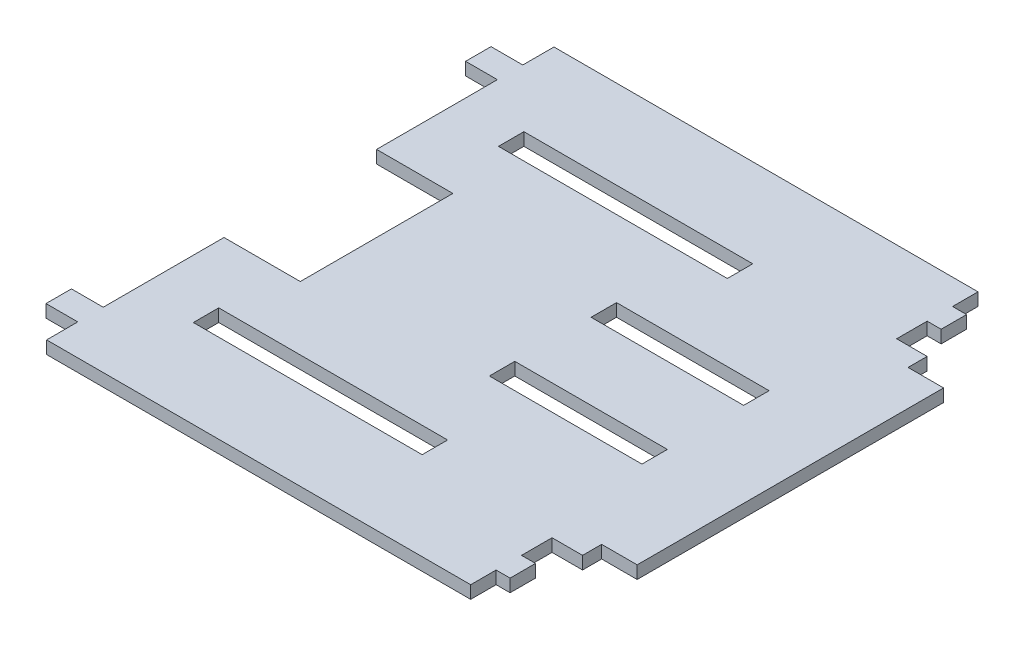
from build123d import *

# Parameters (mm, degrees)
CROQUIS2_W              = 60
CROQUIS2_H              = 10
CROQUIS2_W_2            = 90
SALIENTE_EXTRUIR1_DEPTH = 5
CORTAR_EXTRUIR1_DEPTH   = 10


with BuildPart() as part:
    # Croquis2 → Saliente-Extruir1 (new body)
    with BuildSketch(Plane(origin=(0, 0, 0), x_dir=(1, 0, 0), z_dir=(0, 1, 0))):
        Polygon((119.248757736, -67.751242264), (119.248757736, 67.751242264), (87.248757736, 67.751242264), (87.248757736, 79.751242264), (92.748757736, 79.751242264), (92.748757736, 89.751242264), (87.248757736, 89.751242264), (87.248757736, 99.751242264), (-79.502303886, 99.751242264), (-79.502303886, 87.5), (-92.002303886, 87.5), (-92.002303886, 77.5), (-79.502303886, 77.5), (-79.502303886, 30), (-49.502303886, 30), (-49.502303886, -30), (-79.502303886, -30), (-79.502303886, -77.5), (-92.002303886, -77.5), (-92.002303886, -87.5), (-79.502303886, -87.5), (-79.502303886, -99.751242264), (87.248757736, -99.751242264), (87.248757736, -89.751242264), (92.748757736, -89.751242264), (92.748757736, -79.751242264), (87.248757736, -79.751242264), (87.248757736, -67.751242264), align=None)
        with Locations((49.851646293, 20)):
            Rectangle(CROQUIS2_W, CROQUIS2_H, mode=Mode.SUBTRACT)
        with Locations((49.851646293, -20)):
            Rectangle(CROQUIS2_W, CROQUIS2_H, mode=Mode.SUBTRACT)
        with Locations((-11.573483533, -60)):
            Rectangle(CROQUIS2_W_2, CROQUIS2_H, mode=Mode.SUBTRACT)
        with Locations((-11.573483533, 60)):
            Rectangle(CROQUIS2_W_2, CROQUIS2_H, mode=Mode.SUBTRACT)
    extrude(amount=SALIENTE_EXTRUIR1_DEPTH)

    # Croquis3 → Cortar-Extruir1 (cut)
    with BuildSketch(Plane.XZ):
        Polygon((89.248757736, 68.751242264), (99.248757736, 68.751242264), (99.248757736, 60.25), (113.212609068, 60.25), (113.212609068, -60.25), (99.248757736, -60.25), (99.248757736, -68.751242264), (89.248757736, -68.751242264), (89.248757736, -74.265586854), (126.748190859, -74.265586854), (126.748190859, 75.130473705), (89.248757736, 75.130473705), align=None)
    extrude(amount=-CORTAR_EXTRUIR1_DEPTH, mode=Mode.SUBTRACT)


solid = part.part
